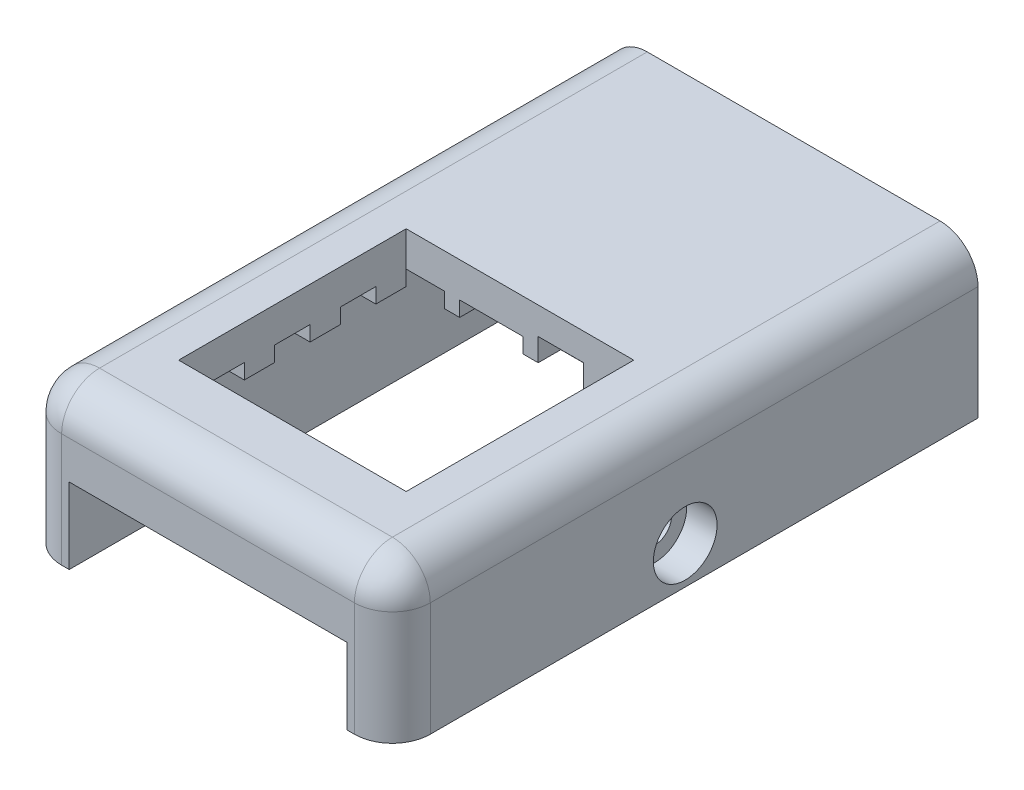
from build123d import *

# Parameters (mm, degrees)
SKETCH1_W                  = 24.3
SKETCH1_H                  = 38.6
BASE_DEPTH                 = 2
SKETCH2_W                  = 24.3
SKETCH2_H                  = 38.6
SKETCH2_W_2                = 18.3
SKETCH2_H_2                = 31.3
PCB_EDGE_WALLS_DEPTH       = 1.7
SKETCH3_R                  = 0.95
PCB_MOUNT_DOWELS_DEPTH     = 1.6
SKETCH4_W                  = 15
SKETCH4_H                  = 15
SILICONE_PAD_HOLE_DEPTH    = 44.646448882
SKETCH6_W                  = 10.4
SKETCH6_H                  = 2.8
WIRE_SOLDERINGS_HOLE_DEPTH = 1.5
SKETCH7_W                  = 3
SKETCH7_H                  = 1.5
CUT_EXTRUDE4_DEPTH         = 1.5
SILICONE_CHANNELS_START    = -1
SKETCH5_R                  = 0.95
SKETCH5_W                  = 5
SKETCH5_H                  = 2.49
SKETCH5_W_2                = 1
SKETCH5_H_2                = 2
SILICONE_CHANNELS_DEPTH    = 1
SKETCH8_W                  = 23.48
SKETCH8_H                  = 1
CUT_EXTRUDE5_DEPTH         = 1
SKETCH9_W                  = 23.48
SKETCH9_H                  = 1
CUT_EXTRUDE6_DEPTH         = 1
FILLET1_R                  = 0.7
SKETCH17_W                 = 3
SKETCH17_H                 = 38.6
BOSS_EXTRUDE4_DEPTH        = 5
SKETCH19_R                 = 1.1
CUT_EXTRUDE9_DEPTH         = 5
SKETCH20_R                 = 2.1
CUT_EXTRUDE10_DEPTH        = 2
SKETCH21_R                 = 1.1
CUT_EXTRUDE11_DEPTH        = 5
SKETCH22_R                 = 2.1
CUT_EXTRUDE12_DEPTH        = 2
SKETCH23_W                 = 24.3
SKETCH23_H                 = 38.6
SKETCH23_W_2               = 15
SKETCH23_H_2               = 15
BOSS_EXTRUDE5_DEPTH        = 1.3
FILLET3_R                  = 2.5


with BuildPart() as part:
    # Sketch1 → base (new body)
    with BuildSketch(Plane(origin=(0, 0, 0), x_dir=(1, 0, 0), z_dir=(0, 1, 0))):
        with Locations((9, 18.7)):
            Rectangle(SKETCH1_W, SKETCH1_H)
    extrude(amount=BASE_DEPTH)

    # Sketch2 → pcb_edge_walls (add)
    with BuildSketch(Plane.XZ):
        with Locations((9, -18.7)):
            Rectangle(SKETCH2_W, SKETCH2_H)
        with Locations((9, -15.5)):
            Rectangle(SKETCH2_W_2, SKETCH2_H_2, mode=Mode.SUBTRACT)
    extrude(amount=PCB_EDGE_WALLS_DEPTH)

    # Sketch3 → pcb_mount_dowels (add)
    with BuildSketch(Plane.XZ):
        with Locations((1.5, -29.46)):
            Circle(SKETCH3_R)
        with Locations((16.5, -29.46)):
            Circle(SKETCH3_R)
        with Locations((9, -3)):
            Circle(SKETCH3_R)
    extrude(amount=PCB_MOUNT_DOWELS_DEPTH)

    # Sketch4 → silicone_pad_hole (cut, through all)
    with BuildSketch(Plane(origin=(0, 2, 0), x_dir=(1, 0, 0), z_dir=(0, 1, 0))):
        with Locations((9, 12.46)):
            Rectangle(SKETCH4_W, SKETCH4_H)
    extrude(amount=-SILICONE_PAD_HOLE_DEPTH, mode=Mode.SUBTRACT)

    # Sketch6 → wire_solderings_hole (cut)
    with BuildSketch(Plane.XZ):
        with Locations((9, -26.6)):
            Rectangle(SKETCH6_W, SKETCH6_H)
    extrude(amount=-WIRE_SOLDERINGS_HOLE_DEPTH, mode=Mode.SUBTRACT)

    # Sketch7 → Cut-Extrude4 (cut)
    with BuildSketch(Plane.XZ):
        with Locations((11.7, -20.7)):
            Rectangle(SKETCH7_W, SKETCH7_H)
    extrude(amount=-CUT_EXTRUDE4_DEPTH, mode=Mode.SUBTRACT)

    # Sketch5 → silicone_channels (cut)
    with BuildSketch(Plane.XZ.offset(SILICONE_CHANNELS_START)):
        Polygon((-0.15, -19.96), (-0.15, -24.2), (18.15, -24.2), (18.15, -0.72), (-0.15, -0.72), align=None)
        with Locations((9, -3)):
            Circle(SKETCH5_R, mode=Mode.SUBTRACT)
        with Locations((11.7, -21.205)):
            Rectangle(SKETCH5_W, SKETCH5_H, mode=Mode.SUBTRACT)
        Polygon((4.025, -19.96), (4.025, -21.45), (2.525, -21.45), (2.525, -22.45), (6.525, -22.45), (6.525, -21.45), (5.025, -21.45), (5.025, -19.96), align=None, mode=Mode.SUBTRACT)
        Polygon((3.858394778, -4.96), (3.858394778, -3.47), (2.358394778, -3.47), (2.358394778, -2.47), (6.358394778, -2.47), (6.358394778, -3.47), (4.858394778, -3.47), (4.858394778, -4.96), align=None, mode=Mode.SUBTRACT)
        Polygon((13.141605222, -4.96), (13.141605222, -3.47), (11.641605222, -3.47), (11.641605222, -2.47), (15.641605222, -2.47), (15.641605222, -3.47), (14.141605222, -3.47), (14.141605222, -4.96), align=None, mode=Mode.SUBTRACT)
        with Locations((1, -5.96)):
            Rectangle(SKETCH5_W_2, SKETCH5_H_2, mode=Mode.SUBTRACT)
        with Locations((1, -10.293333333)):
            Rectangle(SKETCH5_W_2, SKETCH5_H_2, mode=Mode.SUBTRACT)
        with Locations((1, -14.626666667)):
            Rectangle(SKETCH5_W_2, SKETCH5_H_2, mode=Mode.SUBTRACT)
        with Locations((1, -18.96)):
            Rectangle(SKETCH5_W_2, SKETCH5_H_2, mode=Mode.SUBTRACT)
        with Locations((17, -18.96)):
            Rectangle(SKETCH5_W_2, SKETCH5_H_2, mode=Mode.SUBTRACT)
        with Locations((17, -14.626666667)):
            Rectangle(SKETCH5_W_2, SKETCH5_H_2, mode=Mode.SUBTRACT)
        with Locations((17, -10.293333333)):
            Rectangle(SKETCH5_W_2, SKETCH5_H_2, mode=Mode.SUBTRACT)
        with Locations((17, -5.96)):
            Rectangle(SKETCH5_W_2, SKETCH5_H_2, mode=Mode.SUBTRACT)
    extrude(amount=SILICONE_CHANNELS_DEPTH, mode=Mode.SUBTRACT)

    # Sketch8 → Cut-Extrude5 (cut)
    with BuildSketch(Plane(origin=(-0.15, 0, 0), x_dir=(0, 0, -1), z_dir=(1, 0, 0))):
        with Locations((12.46, 0.5)):
            Rectangle(SKETCH8_W, SKETCH8_H)
    extrude(amount=-CUT_EXTRUDE5_DEPTH, mode=Mode.SUBTRACT)

    # Sketch9 → Cut-Extrude6 (cut)
    with BuildSketch(Plane.ZY.offset(-18.15)):
        with Locations((-12.46, 0.5)):
            Rectangle(SKETCH9_W, SKETCH9_H)
    extrude(amount=-CUT_EXTRUDE6_DEPTH, mode=Mode.SUBTRACT)

    # Fillet1
    fillet1_edges = [part.edges().sort_by_distance(p)[0] for p in [
        (19.15, 0, -12.46),
        (-1.15, 0, -12.46),
    ]]
    fillet(fillet1_edges, radius=FILLET1_R)

    # Sketch17 → Boss-Extrude4 (add)
    with BuildSketch(Plane.XZ.offset(1.7)):
        with Locations((-1.65, -18.7)):
            Rectangle(SKETCH17_W, SKETCH17_H)
        with Locations((19.65, -18.7)):
            Rectangle(SKETCH17_W, SKETCH17_H)
    extrude(amount=BOSS_EXTRUDE4_DEPTH)

    # Sketch19 → Cut-Extrude9 (cut)
    with BuildSketch(Plane.ZY.offset(3.15)):
        with Locations((-4.4, -4.2)):
            Circle(SKETCH19_R)
        with Locations((-33, -4.2)):
            Circle(SKETCH19_R)
    extrude(amount=-CUT_EXTRUDE9_DEPTH, mode=Mode.SUBTRACT)

    # Sketch20 → Cut-Extrude10 (cut)
    with BuildSketch(Plane.ZY.offset(3.15)):
        with Locations((-4.4, -4.2)):
            Circle(SKETCH20_R)
        with Locations((-33, -4.2)):
            Circle(SKETCH20_R)
    extrude(amount=-CUT_EXTRUDE10_DEPTH, mode=Mode.SUBTRACT)

    # Sketch21 → Cut-Extrude11 (cut)
    with BuildSketch(Plane(origin=(21.15, 0, 0), x_dir=(0, 0, -1), z_dir=(1, 0, 0))):
        with Locations((18.7, -4.2)):
            Circle(SKETCH21_R)
    extrude(amount=-CUT_EXTRUDE11_DEPTH, mode=Mode.SUBTRACT)

    # Sketch22 → Cut-Extrude12 (cut)
    with BuildSketch(Plane(origin=(21.15, 0, 0), x_dir=(0, 0, -1), z_dir=(1, 0, 0))):
        with Locations((18.7, -4.2)):
            Circle(SKETCH22_R)
    extrude(amount=-CUT_EXTRUDE12_DEPTH, mode=Mode.SUBTRACT)

    # Sketch23 → Boss-Extrude5 (add)
    with BuildSketch(Plane(origin=(0, 2, 0), x_dir=(1, 0, 0), z_dir=(0, 1, 0))):
        with Locations((9, 18.7)):
            Rectangle(SKETCH23_W, SKETCH23_H)
        with Locations((9, 12.46)):
            Rectangle(SKETCH23_W_2, SKETCH23_H_2, mode=Mode.SUBTRACT)
    extrude(amount=BOSS_EXTRUDE5_DEPTH)

    # Fillet3
    fillet3_edges = [part.edges().sort_by_distance(p)[0] for p in [
        (21.15, -1.7, 0.6),
        (-3.15, -1.7, 0.6),
        (-3.15, 3.3, -18.7),
        (9, 3.3, 0.6),
        (21.15, 3.3, -18.7),
    ]]
    fillet(fillet3_edges, radius=FILLET3_R)


solid = part.part
